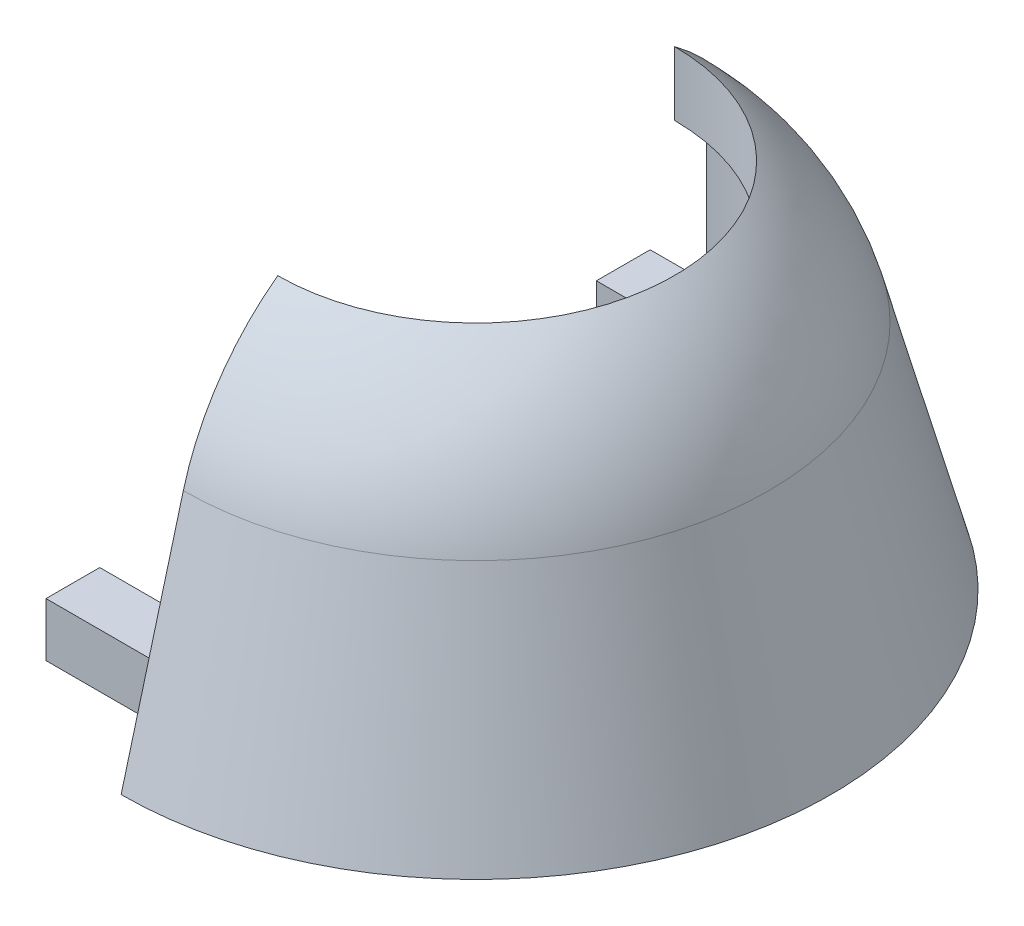
from build123d import *

# Parameters (mm, degrees)
BOSS_EXTRUDE1_DEPTH = 24
BOSS_EXTRUDE2_DEPTH = 5
CHAMFER1_SIZE       = 8.038475773
CHAMFER1_SIZE_2     = 30
FILLET1_R           = 20
SKETCH3_W           = 4.2
SKETCH3_H           = 4.2
BOSS_EXTRUDE3_DEPTH = 10


with BuildPart() as part:
    # Sketch1 → Boss-Extrude1 (new body)
    with BuildSketch(Plane(origin=(0, 0, 0), x_dir=(1, 0, 0), z_dir=(0, 1, 0))):
        with BuildLine():
            Line((0, 28), (0, 18))
            ThreePointArc((0, 18), (18, 0), (0, -18))
            Line((0, -18), (0, -28))
            ThreePointArc((0, -28), (28, 0), (0, 28))
        make_face()
    extrude(amount=BOSS_EXTRUDE1_DEPTH)

    # Sketch2 → Boss-Extrude2 (add)
    with BuildSketch(Plane(origin=(0, 24, 0), x_dir=(1, 0, 0), z_dir=(0, 1, 0))):
        with BuildLine():
            Line((0, 28), (0, 15.5))
            ThreePointArc((0, 15.5), (15.5, 0), (0, -15.5))
            Line((0, -15.5), (0, -28))
            ThreePointArc((0, -28), (28, 0), (0, 28))
        make_face()
    extrude(amount=BOSS_EXTRUDE2_DEPTH)

    # Chamfer1
    # the kernel refuses this chamfer: 30, 8.038475773 mm, written as the material it takes off along each edge
    with BuildSketch(Plane(origin=(0, 29, 0), x_dir=(-0.9999950652018581, 0, 0.0031415874858793337), z_dir=(-0.0031415874858793337, 0, -0.9999950652018581))) as chamfer1_piece_1:
        Polygon((28 - CHAMFER1_SIZE, 0), (28, -CHAMFER1_SIZE_2), (28, 0), align=None)
    revolve(axis=Axis((0, 29, 0), (0, 1, 0)), revolution_arc=359.64, mode=Mode.SUBTRACT)

    # Fillet1
    # the kernel refuses this fillet: 20 mm, written as the material it takes off along each edge
    with BuildSketch(Plane(origin=(0, 29, 0), x_dir=(-0.9872402067146837, 0, 0.1592381055085398), z_dir=(-0.1592381055085398, 0, -0.9872402067146837))) as fillet1_piece_1:
        with BuildLine():
            CenterArc((3.55400198, -16.040359451), FILLET1_R, 15, 38.323238927)
            Line((15.5, 0), (15.73891996, 0.320807189))
            ThreePointArc((15.73891996, 0.320807189), (17.730762114, 0.4), (19.961524227, 0.4))
            Line((19.961524227, 0.4), (20.347894558, 0.103527618))
            Line((20.347894558, 0.103527618), (23.258888836, -10.76045093))
            Line((23.258888836, -10.76045093), (22.872518506, -10.863978548))
        make_face()
    revolve(axis=Axis((0, 29, 0), (0, 1, 0)), revolution_arc=341.674648162, mode=Mode.SUBTRACT)

    # Sketch3 → Boss-Extrude3 (add)
    with BuildSketch(Plane.ZY):
        with Locations((21.5, 4.1)):
            Rectangle(SKETCH3_W, SKETCH3_H)
        with Locations((-21.5, 4.1)):
            Rectangle(SKETCH3_W, SKETCH3_H)
    extrude(amount=BOSS_EXTRUDE3_DEPTH)


solid = part.part
